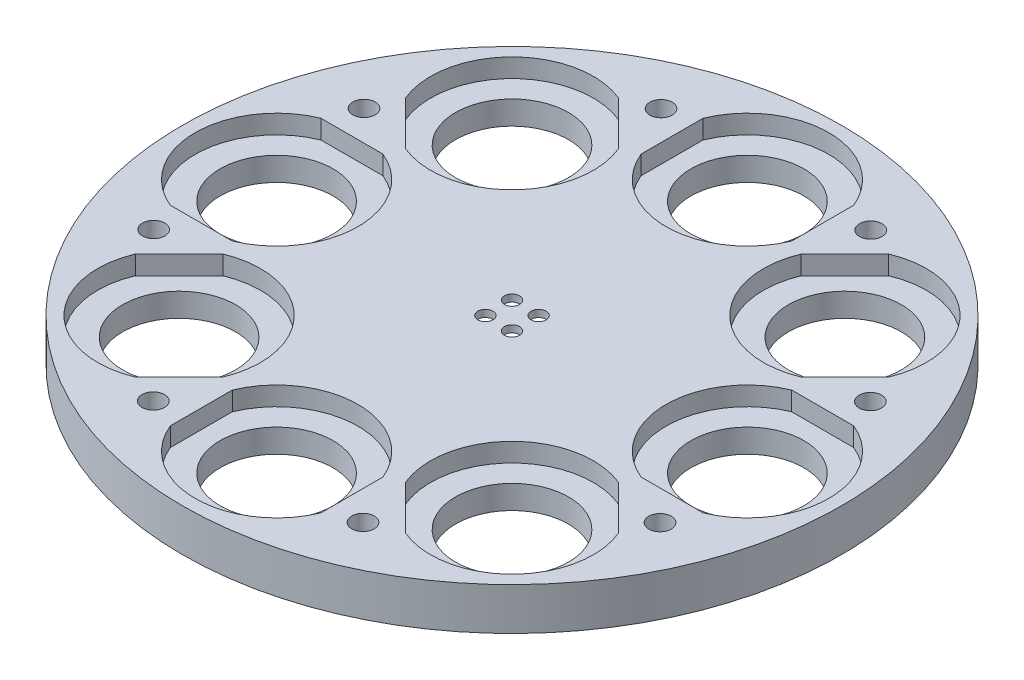
from build123d import *

# Parameters (mm, degrees)
SKETCH1_R           = 70
SKETCH1_R_2         = 12
BOSS_EXTRUDE1_DEPTH = 25
CUT_EXTRUDE1_DEPTH  = 10
SKETCH3_R           = 20
CUT_EXTRUDE2_DEPTH  = 7.5
CUT_EXTRUDE3_START  = -6
SKETCH4_R           = 70
CUT_EXTRUDE3_DEPTH  = 6
SKETCH5_R           = 1.6
CUT_EXTRUDE4_DEPTH  = 100.278648258
SKETCH7_R           = 2.38125
CUT_EXTRUDE5_DEPTH  = 100.403219264


with BuildPart() as part:
    # Sketch1 → Boss-Extrude1 (new body)
    with BuildSketch(Plane(origin=(0, 0, 0), x_dir=(1, 0, 0), z_dir=(0, 1, 0))):
        Circle(SKETCH1_R)
        with Locations((50, 0)):
            Circle(SKETCH1_R_2, mode=Mode.SUBTRACT)
        with Locations((35.355339059, -35.355339059)):
            Circle(SKETCH1_R_2, mode=Mode.SUBTRACT)
        with Locations((0, -50)):
            Circle(SKETCH1_R_2, mode=Mode.SUBTRACT)
        with Locations((-35.355339059, -35.355339059)):
            Circle(SKETCH1_R_2, mode=Mode.SUBTRACT)
        with Locations((-50, 0)):
            Circle(SKETCH1_R_2, mode=Mode.SUBTRACT)
        with Locations((-35.355339059, 35.355339059)):
            Circle(SKETCH1_R_2, mode=Mode.SUBTRACT)
        with Locations((0, 50)):
            Circle(SKETCH1_R_2, mode=Mode.SUBTRACT)
        with Locations((35.355339059, 35.355339059)):
            Circle(SKETCH1_R_2, mode=Mode.SUBTRACT)
    extrude(amount=BOSS_EXTRUDE1_DEPTH)

    # Sketch2 → Cut-Extrude1 (cut)
    with BuildSketch(Plane(origin=(0, 25, 0), x_dir=(1, 0, 0), z_dir=(0, 1, 0))):
        with BuildLine():
            Line((50, 16), (43.42048634, 16))
            ThreePointArc((43.42048634, 16), (32.7, 0), (43.42048634, -16))
            Line((43.42048634, -16), (50, -16))
            Line((50, -16), (56.57951366, -16))
            ThreePointArc((56.57951366, -16), (67.3, 0), (56.57951366, 16))
            Line((56.57951366, 16), (50, 16))
        make_face()
        with BuildLine():
            Line((46.669047558, -24.04163056), (42.016628833, -19.389211835))
            ThreePointArc((42.016628833, -19.389211835), (23.122391745, -23.122391745), (19.389211835, -42.016628833))
            Line((19.389211835, -42.016628833), (24.04163056, -46.669047558))
            Line((24.04163056, -46.669047558), (28.694049286, -51.321466284))
            ThreePointArc((28.694049286, -51.321466284), (47.588286374, -47.588286374), (51.321466284, -28.694049286))
            Line((51.321466284, -28.694049286), (46.669047558, -24.04163056))
        make_face()
        with BuildLine():
            Line((16, -50), (16, -43.42048634))
            ThreePointArc((16, -43.42048634), (0, -32.7), (-16, -43.42048634))
            Line((-16, -43.42048634), (-16, -50))
            Line((-16, -50), (-16, -56.57951366))
            ThreePointArc((-16, -56.57951366), (0, -67.3), (16, -56.57951366))
            Line((16, -56.57951366), (16, -50))
        make_face()
        with BuildLine():
            Line((-24.04163056, -46.669047558), (-19.389211835, -42.016628833))
            ThreePointArc((-19.389211835, -42.016628833), (-23.122391745, -23.122391745), (-42.016628833, -19.389211835))
            Line((-42.016628833, -19.389211835), (-46.669047558, -24.04163056))
            Line((-46.669047558, -24.04163056), (-51.321466284, -28.694049286))
            ThreePointArc((-51.321466284, -28.694049286), (-47.588286374, -47.588286374), (-28.694049286, -51.321466284))
            Line((-28.694049286, -51.321466284), (-24.04163056, -46.669047558))
        make_face()
        with BuildLine():
            Line((-50, -16), (-43.42048634, -16))
            ThreePointArc((-43.42048634, -16), (-32.7, 0), (-43.42048634, 16))
            Line((-43.42048634, 16), (-50, 16))
            Line((-50, 16), (-56.57951366, 16))
            ThreePointArc((-56.57951366, 16), (-67.3, 0), (-56.57951366, -16))
            Line((-56.57951366, -16), (-50, -16))
        make_face()
        with BuildLine():
            Line((-46.669047558, 24.04163056), (-42.016628833, 19.389211835))
            ThreePointArc((-42.016628833, 19.389211835), (-23.122391745, 23.122391745), (-19.389211835, 42.016628833))
            Line((-19.389211835, 42.016628833), (-24.04163056, 46.669047558))
            Line((-24.04163056, 46.669047558), (-28.694049286, 51.321466284))
            ThreePointArc((-28.694049286, 51.321466284), (-47.588286374, 47.588286374), (-51.321466284, 28.694049286))
            Line((-51.321466284, 28.694049286), (-46.669047558, 24.04163056))
        make_face()
        with BuildLine():
            Line((-16, 50), (-16, 43.42048634))
            ThreePointArc((-16, 43.42048634), (0, 32.7), (16, 43.42048634))
            Line((16, 43.42048634), (16, 50))
            Line((16, 50), (16, 56.57951366))
            ThreePointArc((16, 56.57951366), (0, 67.3), (-16, 56.57951366))
            Line((-16, 56.57951366), (-16, 50))
        make_face()
        with BuildLine():
            Line((24.04163056, 46.669047558), (19.389211835, 42.016628833))
            ThreePointArc((19.389211835, 42.016628833), (23.122391745, 23.122391745), (42.016628833, 19.389211835))
            Line((42.016628833, 19.389211835), (46.669047558, 24.04163056))
            Line((46.669047558, 24.04163056), (51.321466284, 28.694049286))
            ThreePointArc((51.321466284, 28.694049286), (47.588286374, 47.588286374), (28.694049286, 51.321466284))
            Line((28.694049286, 51.321466284), (24.04163056, 46.669047558))
        make_face()
    extrude(amount=-CUT_EXTRUDE1_DEPTH, mode=Mode.SUBTRACT)


with BuildPart() as body_2:
    # Split1: the piece on the far side of the plane
    add(part.part)
    split(bisect_by=Plane.ZX.offset(10), keep=Keep.BOTTOM)


with BuildPart() as part_1:
    add(part.part)

    # Split1
    split(bisect_by=Plane.ZX.offset(10), keep=Keep.TOP)

    # Sketch3 → Cut-Extrude2 (cut)
    with BuildSketch(Plane.XZ.offset(-10)):
        Circle(SKETCH3_R)
    extrude(amount=-CUT_EXTRUDE2_DEPTH, mode=Mode.SUBTRACT)

    # Sketch4 → Cut-Extrude3 (cut)
    with BuildSketch(Plane(origin=(0, 25, 0), x_dir=(1, 0, 0), z_dir=(0, 1, 0)).offset(CUT_EXTRUDE3_START)):
        Circle(SKETCH4_R)
    extrude(amount=CUT_EXTRUDE3_DEPTH, mode=Mode.SUBTRACT)

    # Sketch5 → Cut-Extrude4 (cut, through all)
    with BuildSketch(Plane.XZ.offset(-17.5)):
        with Locations((2.825415776, 2.831435271)):
            Circle(SKETCH5_R)
        with Locations((2.831435271, -2.825415776)):
            Circle(SKETCH5_R)
        with Locations((-2.825415776, -2.831435271)):
            Circle(SKETCH5_R)
        with Locations((-2.831435271, 2.825415776)):
            Circle(SKETCH5_R)
    extrude(amount=-CUT_EXTRUDE4_DEPTH, mode=Mode.SUBTRACT)

    # Sketch7 → Cut-Extrude5 (cut, through all)
    with BuildSketch(Plane(origin=(0, 19, 0), x_dir=(1, 0, 0), z_dir=(0, 1, 0))):
        with Locations((-22.229511812, 53.882002374)):
            Circle(SKETCH7_R)
        with Locations((22.381690718, 53.818967807)):
            Circle(SKETCH7_R)
        with Locations((53.882002374, 22.229511812)):
            Circle(SKETCH7_R)
        with Locations((53.818967807, -22.381690718)):
            Circle(SKETCH7_R)
        with Locations((22.229511812, -53.882002374)):
            Circle(SKETCH7_R)
        with Locations((-22.381690718, -53.818967807)):
            Circle(SKETCH7_R)
        with Locations((-53.882002374, -22.229511812)):
            Circle(SKETCH7_R)
        with Locations((-53.818967807, 22.381690718)):
            Circle(SKETCH7_R)
    extrude(amount=-CUT_EXTRUDE5_DEPTH, mode=Mode.SUBTRACT)


solid = part_1.part
